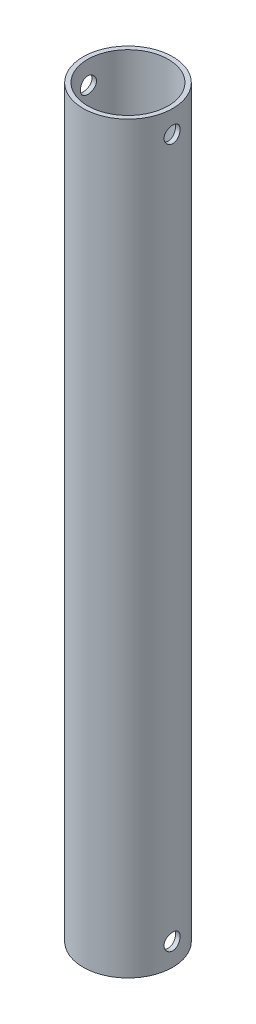
from build123d import *

# Parameters (mm, degrees)
SKETCH1_R            = 10
SKETCH1_R_2          = 9
BOSS_EXTRUDE1_DEPTH  = 166
M3_CLEARANCE_HOLE1_D = 3.6


with BuildPart() as part:
    # Sketch1 → Boss-Extrude1 (new body)
    with BuildSketch(Plane(origin=(0, 0, 0), x_dir=(1, 0, 0), z_dir=(0, 1, 0))):
        Circle(SKETCH1_R)
        Circle(SKETCH1_R_2, mode=Mode.SUBTRACT)
    extrude(amount=BOSS_EXTRUDE1_DEPTH)

    # M3 Clearance Hole1 (through all)
    with Locations(Plane(origin=(10, 0, 0), x_dir=(0, 0, -1), z_dir=(1, 0, 0))):
        with Locations((0, 5)):
            m3_clearance_hole1 = Hole(M3_CLEARANCE_HOLE1_D / 2)

    # Mirror1: M3 Clearance Hole1 across plane
    add(m3_clearance_hole1.mirror(Plane.ZX.offset(83)), mode=Mode.SUBTRACT)


solid = part.part
